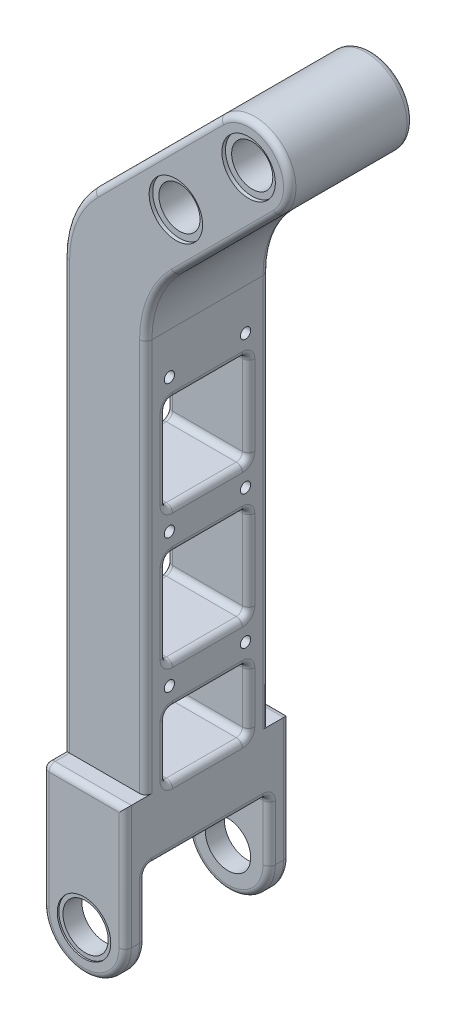
from build123d import *

# Parameters (mm, degrees)
SKETCH_1_R             = 20
SKETCH_1_R_2           = 10
EXTRUDE_1_DEPTH        = 60
EXTRUDE_2_DEPTH        = 30
SKETCH_4_R             = 11
EXTRUDE_3_DEPTH        = 10
SKETCH_8_R             = 10
CUT_EXTRUDE_1_DEPTH    = 100
FILLET_1_R             = 50
FILLET_2_R             = 3
SKETCH_9_R             = 13
CUT_EXTRUDE_2_DEPTH    = 0.75
CUT_EXTRUDE_START      = -0.75
SKETCH_10_R            = 13
CUT_EXTRUDE_3_DEPTH    = 0.75
SKETCH_11_R            = 2.5
CUT_EXTRUDE_4_DEPTH    = 393.300904947
SKETCH_12_W            = 40
SKETCH_12_H            = 45
SKETCH_12_H_2          = 31.005050634
CUT_EXTRUDE_5514_DEPTH = 393.300904947
FILLET_3_R             = 3
SKETCH_13_R            = 13
CUT_EXTRUDE_6_DEPTH    = 1.75
CUT_EXTRUDE_START_2    = -1.75
SKETCH_14_R            = 13
CUT_EXTRUDE_7_DEPTH    = 1.75


with BuildPart() as part:
    # 草图1 → 凸台-拉伸1 (new body)
    with BuildSketch(Plane.XY):
        Circle(SKETCH_1_R)
        Circle(SKETCH_1_R_2, mode=Mode.SUBTRACT)
    extrude(amount=EXTRUDE_1_DEPTH)

    # 草图2 → 凸台-拉伸2 (add, symmetric)
    with BuildSketch(Plane.XY.offset(30)):
        with BuildLine():
            Line((-14.142135624, 14.142135624), (-90, -61.715728753))
            Line((-90, -61.715728753), (-90, -320))
            Line((-90, -320), (-50, -320))
            Line((-50, -320), (-50, -78.284271247))
            Line((-50, -78.284271247), (14.142135624, -14.142135624))
            ThreePointArc((14.142135624, -14.142135624), (-14.142135624, -14.142135624), (-14.142135624, 14.142135624))
        make_face()
    extrude(amount=EXTRUDE_2_DEPTH, both=True)

    # 草图4 → 凸台-拉伸3 (add)
    with BuildSketch(Plane.XY.offset(60)):
        with BuildLine():
            Line((-90, -290), (-50, -290))
            Line((-50, -290), (-50, -350))
            ThreePointArc((-50, -350), (-70, -370), (-90, -350))
            Line((-90, -350), (-90, -290))
        make_face()
        with Locations((-70, -350)):
            Circle(SKETCH_4_R, mode=Mode.SUBTRACT)
    extrude_3 = extrude(amount=EXTRUDE_3_DEPTH)

    # 镜向1: 凸台-拉伸3 across plane
    add(extrude_3.mirror(Plane.XY.offset(30)))

    # 草图8 → 切除-拉伸1 (cut)
    with BuildSketch(Plane.XY.offset(60)):
        with Locations((-35.355339059, -35.355339059)):
            Circle(SKETCH_8_R)
    extrude(amount=-CUT_EXTRUDE_1_DEPTH, mode=Mode.SUBTRACT)

    # 圆角1
    fillet_1_edges = [part.edges().sort_by_distance(p)[0] for p in [
        (-90, -61.715728753, 30),
        (-50, -78.284271247, 30),
    ]]
    fillet(fillet_1_edges, radius=FILLET_1_R)

    # 圆角2
    fillet_2_edges = [part.edges().sort_by_distance(p)[0] for p in [
        (-50, -320, 70),
        (-70, -370, 70),
        (-50, -335, 60),
        (-70, -370, 60),
        (-50, -335, 0),
        (-70, -370, 0),
        (-50, -320, -10),
        (-70, -370, -10),
        (-70, -320, 60),
        (-50, -320, 30),
        (-70, -320, 0),
        (-90, -290, 65),
        (-90, -320, 70),
        (-90, -335, 60),
        (-90, -320, 30),
        (-90, -335, 0),
        (-90, -320, -10),
        (-90, -290, -5),
        (-50, -194.497474683, 0),
        (-46.193976626, -79.860777748, 0),
        (-10.606601718, -38.890872965, 0),
        (14.142135624, 14.142135624, 0),
        (-44.748737342, -16.464466094, 0),
        (-86.193976626, -63.292235253, 0),
        (-90, -186.213203436, 0),
        (14.142135624, 14.142135624, 60),
        (-10.606601718, -38.890872965, 60),
        (-46.193976626, -79.860777748, 60),
        (-50, -194.497474683, 60),
        (-90, -186.213203436, 60),
        (-86.193976626, -63.292235253, 60),
        (-44.748737342, -16.464466094, 60),
        (-70, -290, 70),
        (-70, -290, -10),
    ]]
    fillet(fillet_2_edges, radius=FILLET_2_R)

    # 草图9 → 切除-拉伸2 (cut)
    with BuildSketch(Plane.XY.offset(70)):
        with Locations((-70, -350)):
            Circle(SKETCH_9_R)
    extrude(amount=-CUT_EXTRUDE_2_DEPTH, mode=Mode.SUBTRACT)

    # 草图10 → 切除-拉伸3 (cut)
    with BuildSketch(Plane(origin=(0, 0, -10), x_dir=(-1, 0, 0), z_dir=(0, 0, -1)).offset(CUT_EXTRUDE_START)):
        with Locations((70, -350)):
            Circle(SKETCH_10_R)
    extrude(amount=CUT_EXTRUDE_3_DEPTH, mode=Mode.SUBTRACT)

    # 草图11 → 切除-拉伸4 (cut, through all)
    with BuildSketch(Plane.ZY.offset(90)):
        with Locations((48.5, -118.994949366)):
            Circle(SKETCH_11_R)
        with Locations((48.5, -183.994949366)):
            Circle(SKETCH_11_R)
        with Locations((48.5, -248.994949366)):
            Circle(SKETCH_11_R)
        with Locations((11.5, -248.994949366)):
            Circle(SKETCH_11_R)
        with Locations((11.5, -183.994949366)):
            Circle(SKETCH_11_R)
        with Locations((11.5, -118.994949366)):
            Circle(SKETCH_11_R)
    extrude(amount=-CUT_EXTRUDE_4_DEPTH, mode=Mode.SUBTRACT)

    # 草图12 → Cut-Extrude 5514 (cut, through all)
    with BuildSketch(Plane.ZY.offset(90)):
        with Locations((30, -151.494949366)):
            Rectangle(SKETCH_12_W, SKETCH_12_H)
        with Locations((30, -216.494949366)):
            Rectangle(SKETCH_12_W, SKETCH_12_H)
        with Locations((30, -274.497474683)):
            Rectangle(SKETCH_12_W, SKETCH_12_H_2)
    extrude(amount=-CUT_EXTRUDE_5514_DEPTH, mode=Mode.SUBTRACT)

    # 圆角3
    fillet_3_edges = [part.edges().sort_by_distance(p)[0] for p in [
        (-90, -258.994949366, 30),
        (-50, -258.994949366, 30),
        (-50, -290, 30),
        (-90, -290, 30),
        (-50, -238.994949366, 30),
        (-50, -193.994949366, 30),
        (-90, -193.994949366, 30),
        (-90, -238.994949366, 30),
        (-50, -173.994949366, 30),
        (-90, -173.994949366, 30),
        (-50, -128.994949366, 30),
        (-90, -128.994949366, 30),
        (-70, -290, 10),
        (-90, -274.497474683, 10),
        (-70, -258.994949366, 10),
        (-50, -274.497474683, 10),
        (-50, -274.497474683, 50),
        (-70, -258.994949366, 50),
        (-90, -274.497474683, 50),
        (-70, -290, 50),
        (-50, -216.494949366, 50),
        (-70, -193.994949366, 50),
        (-90, -216.494949366, 50),
        (-70, -238.994949366, 50),
        (-70, -238.994949366, 10),
        (-90, -216.494949366, 10),
        (-70, -193.994949366, 10),
        (-50, -216.494949366, 10),
        (-70, -173.994949366, 10),
        (-90, -151.494949366, 10),
        (-70, -128.994949366, 10),
        (-50, -151.494949366, 10),
        (-50, -151.494949366, 50),
        (-70, -128.994949366, 50),
        (-90, -151.494949366, 50),
        (-70, -173.994949366, 50),
    ]]
    fillet(fillet_3_edges, radius=FILLET_3_R)

    # 草图13 → 切除-拉伸6 (cut)
    with BuildSketch(Plane.XY.offset(60)):
        Circle(SKETCH_13_R)
        with Locations((-35.355339059, -35.355339059)):
            Circle(SKETCH_13_R)
    extrude(amount=-CUT_EXTRUDE_6_DEPTH, mode=Mode.SUBTRACT)

    # 草图14 → 切除-拉伸7 (cut)
    with BuildSketch(Plane(origin=(0, 0, 0), x_dir=(-1, 0, 0), z_dir=(0, 0, -1)).offset(CUT_EXTRUDE_START_2)):
        Circle(SKETCH_14_R)
        with Locations((35.355339059, -35.355339059)):
            Circle(SKETCH_14_R)
    extrude(amount=CUT_EXTRUDE_7_DEPTH, mode=Mode.SUBTRACT)


solid = part.part
